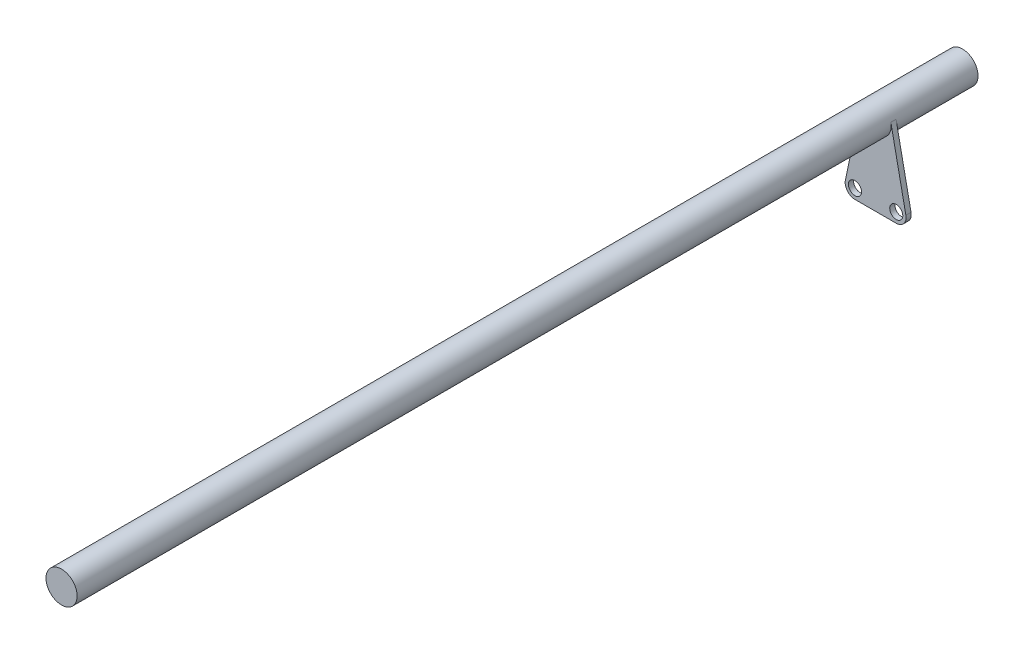
from build123d import *
from build123d.topology import SkipClean

# Parameters (mm, degrees)
SKETCH1_R           = 9.525
BOSS_EXTRUDE1_DEPTH = 250
BOSS_EXTRUDE2_DEPTH = 1.5875
CUT_EXTRUDE1_REACH  = 503.261
SKETCH3_R           = 4
SKETCH4_R           = 9.525
BOSS_EXTRUDE3_DEPTH = 50


with BuildPart() as part:
    # Sketch1 → Boss-Extrude1 (new, symmetric)
    with BuildSketch(Plane.XY):
        Circle(SKETCH1_R)
    extrude(amount=BOSS_EXTRUDE1_DEPTH, both=True)

    # Sketch2 → Boss-Extrude2 (add, symmetric)
    with SkipClean():  # the faces are left unmerged after this step: merging them gives an invalid solid
        with BuildSketch(Plane(origin=(0, 0, -250), x_dir=(-1, 0, 0), z_dir=(0, 0, -1))):
            with BuildLine():
                Line((-9.32999835, 1.91748684), (-18.518650577, -42.792134274))
                ThreePointArc((-18.518650577, -42.792134274), (-17.291604236, -47.791622716), (-12.641486262, -50))
                Line((-12.641486262, -50), (12.641486262, -50))
                ThreePointArc((12.641486262, -50), (17.291604236, -47.791622716), (18.518650577, -42.792134274))
                Line((18.518650577, -42.792134274), (9.32999835, 1.91748684))
                ThreePointArc((9.32999835, 1.91748684), (0, 9.525), (-9.32999835, 1.91748684))
            make_face()
        extrude(amount=BOSS_EXTRUDE2_DEPTH, both=True)
    add(part.part.scale(1), mode=Mode.REPLACE)  # the faces are merged on a copy

    # Sketch3 → Cut-Extrude1 (cut, up to next)
    with BuildSketch(Plane.XY.offset(-248.4125), mode=Mode.PRIVATE) as cut_extrude1_sk1:
        with Locations((-12.641486262, -44)):
            Circle(SKETCH3_R)
    cut_extrude1_tool1 = extrude(cut_extrude1_sk1.sketch, amount=-CUT_EXTRUDE1_REACH, mode=Mode.PRIVATE) & part.part
    # Sketch3 → Cut-Extrude1 (cut, up to next)
    with BuildSketch(Plane.XY.offset(-248.4125), mode=Mode.PRIVATE) as cut_extrude1_sk2:
        with Locations((12.641486262, -44)):
            Circle(SKETCH3_R)
    cut_extrude1_tool2 = extrude(cut_extrude1_sk2.sketch, amount=-CUT_EXTRUDE1_REACH, mode=Mode.PRIVATE) & part.part
    add(cut_extrude1_tool1.solids().sort_by_distance((-12.641486, -44, -248.4125))[0], mode=Mode.SUBTRACT)
    add(cut_extrude1_tool2.solids().sort_by_distance((12.641486, -44, -248.4125))[0], mode=Mode.SUBTRACT)

    # Sketch4 → Boss-Extrude3 (add)
    with BuildSketch(Plane(origin=(0, 0, -251.5875), x_dir=(-1, 0, 0), z_dir=(0, 0, -1))):
        Circle(SKETCH4_R)
    extrude(amount=BOSS_EXTRUDE3_DEPTH)


solid = part.part
